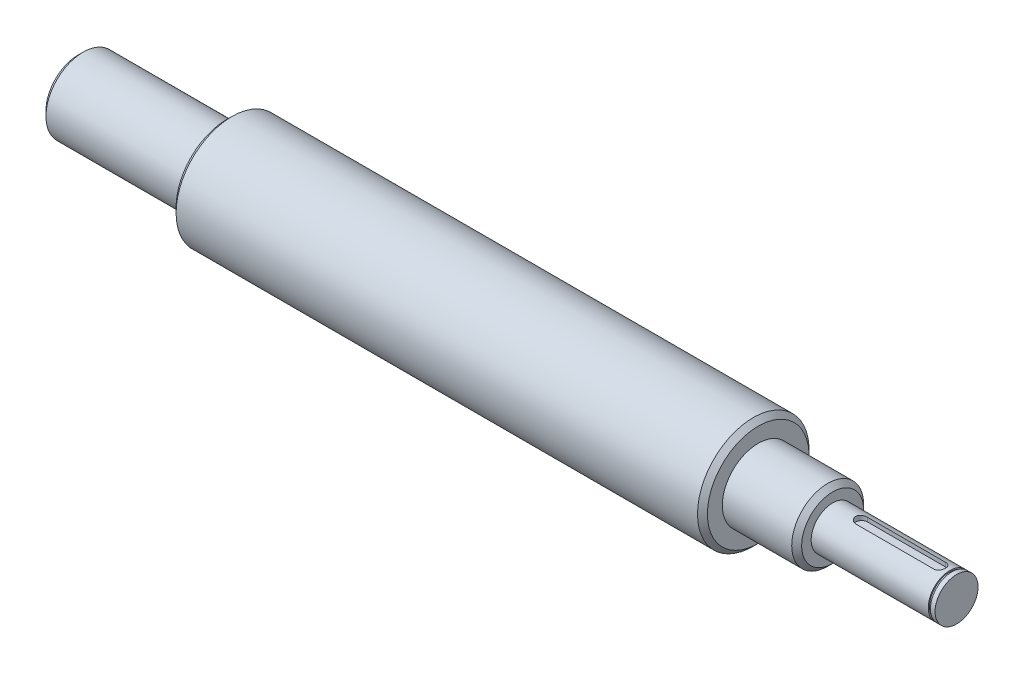
from build123d import *

# Parameters (mm, degrees)
CHAMFER1_SIZE      = 2.54
CHAMFER2_SIZE      = 2.54
FILLET1_R          = 2.54
CUT_EXTRUDE2_DEPTH = 2.5
SKETCH7_R          = 11
SKETCH7_R_2        = 10.35
CUT_EXTRUDE3_DEPTH = 1.1


with BuildPart() as part:
    # Sketch1 → Revolve1 (revolve)
    with BuildSketch(Plane.XY):
        Polygon((-224.999999961, 0), (224.999999961, 0), (224.999999961, 11), (161.499999961, 11), (161.499999961, 18.415), (123.399999961, 18.415), (123.399999961, 28.575), (-148.799999961, 28.575), (-148.799999961, 19.05), (-224.999999961, 19.05), align=None)
    revolve(axis=Axis((-1910.961105754, 0, 0), (1, 0, 0)))

    # Chamfer1
    chamfer1_edges = [part.edges().sort_by_distance(p)[0] for p in [
        (161.499999961, -18.415, 0),
        (123.399999961, -28.575, 0),
    ]]
    chamfer(chamfer1_edges, length=CHAMFER1_SIZE)

    # Chamfer2
    chamfer2_edges = [part.edges().sort_by_distance(p)[0] for p in [
        (-148.799999961, -28.575, 0),
        (-224.999999961, -19.05, 0),
    ]]
    chamfer(chamfer2_edges, length=CHAMFER2_SIZE)

    # Fillet1
    fillet1_edges = [part.edges().sort_by_distance(p)[0] for p in [
        (-148.799999961, -19.05, 0),
    ]]
    fillet(fillet1_edges, radius=FILLET1_R)

    # Sketch3 → Cut-Extrude2 (cut)
    with BuildSketch(Plane(origin=(0, 11, 0), x_dir=(1, 0, 0), z_dir=(0, 1, 0))):
        with BuildLine():
            Line((176.374999961, 3), (216.374999961, 3))
            ThreePointArc((216.374999961, 3), (219.374999961, 0), (216.374999961, -3))
            Line((216.374999961, -3), (176.374999961, -3))
            ThreePointArc((176.374999961, -3), (173.374999961, 0), (176.374999961, 3))
        make_face()
    extrude(amount=-CUT_EXTRUDE2_DEPTH, mode=Mode.SUBTRACT)

    # Sketch7 → Cut-Extrude3 (cut)
    with BuildSketch(Plane(origin=(221.497679961, 0, 0), x_dir=(0, 0, -1), z_dir=(1, 0, 0))):
        Circle(SKETCH7_R)
        Circle(SKETCH7_R_2, mode=Mode.SUBTRACT)
    extrude(amount=CUT_EXTRUDE3_DEPTH, mode=Mode.SUBTRACT)


solid = part.part
